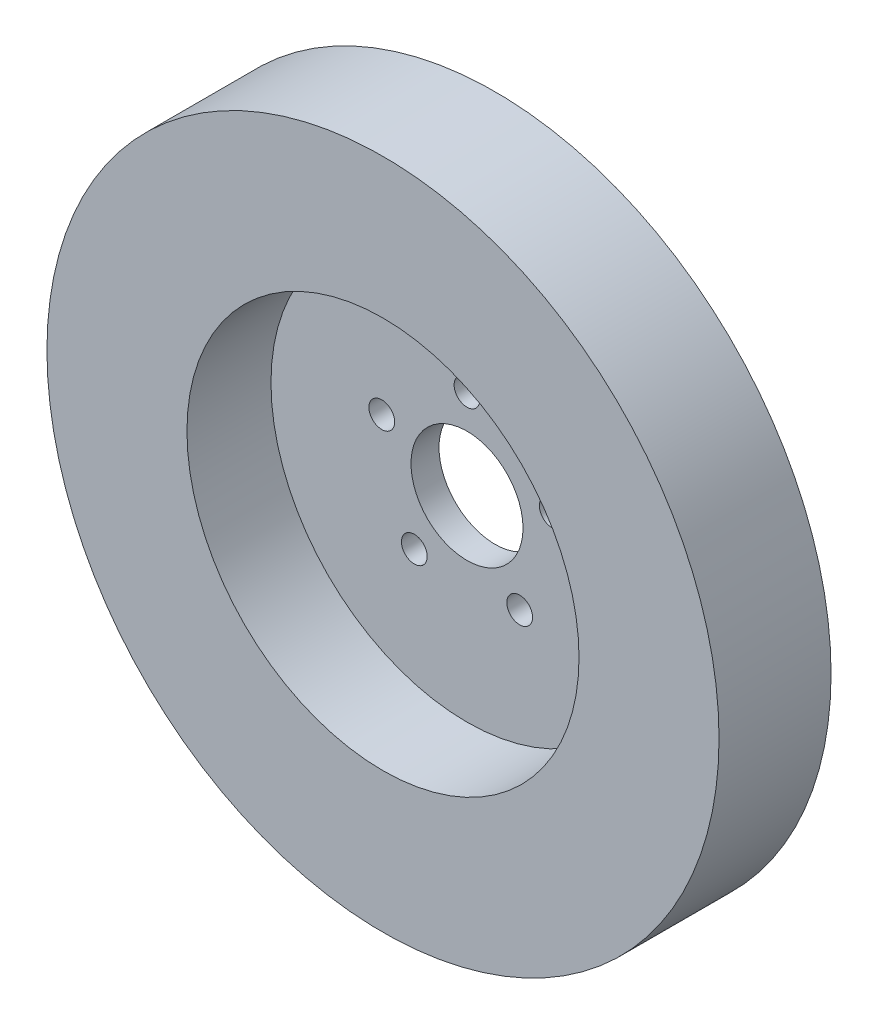
from build123d import *

# Parameters (mm, degrees)
SKETCH1_R           = 76.2
SKETCH1_R_2         = 12.7
SKETCH1_R_3         = 2.921
BOSS_EXTRUDE2_DEPTH = 25.4
SKETCH2_R           = 44.45
CUT_EXTRUDE1_DEPTH  = 19.05


with BuildPart() as part:
    # Sketch1 → Boss-Extrude2 (new body)
    with BuildSketch(Plane.XY):
        Circle(SKETCH1_R)
        Circle(SKETCH1_R_2, mode=Mode.SUBTRACT)
        with Locations((0, 20.32)):
            Circle(SKETCH1_R_3, mode=Mode.SUBTRACT)
        with Locations((19.325468411, 6.279225326)):
            Circle(SKETCH1_R_3, mode=Mode.SUBTRACT)
        with Locations((11.943796327, -16.439225326)):
            Circle(SKETCH1_R_3, mode=Mode.SUBTRACT)
        with Locations((-11.943796327, -16.439225326)):
            Circle(SKETCH1_R_3, mode=Mode.SUBTRACT)
        with Locations((-19.325468411, 6.279225326)):
            Circle(SKETCH1_R_3, mode=Mode.SUBTRACT)
    extrude(amount=BOSS_EXTRUDE2_DEPTH)

    # Sketch2 → Cut-Extrude1 (cut)
    with BuildSketch(Plane.XY.offset(25.4)):
        Circle(SKETCH2_R)
    extrude(amount=-CUT_EXTRUDE1_DEPTH, mode=Mode.SUBTRACT)


solid = part.part
